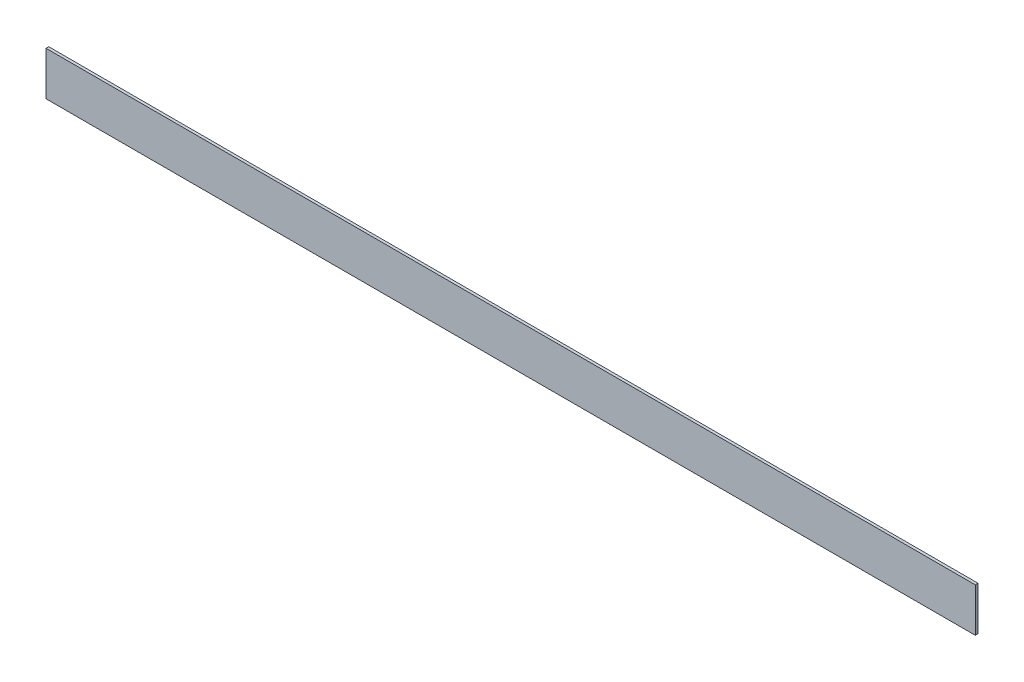
from build123d import *

# Parameters (mm, degrees)
SKETCH1_W           = 539.75
SKETCH1_H           = 25.4
BOSS_EXTRUDE1_DEPTH = 1.5875


with BuildPart() as part:
    # Sketch1 → Boss-Extrude1 (new body)
    with BuildSketch(Plane.XY):
        with Locations((269.875, 12.7)):
            Rectangle(SKETCH1_W, SKETCH1_H)
    extrude(amount=BOSS_EXTRUDE1_DEPTH)


solid = part.part
